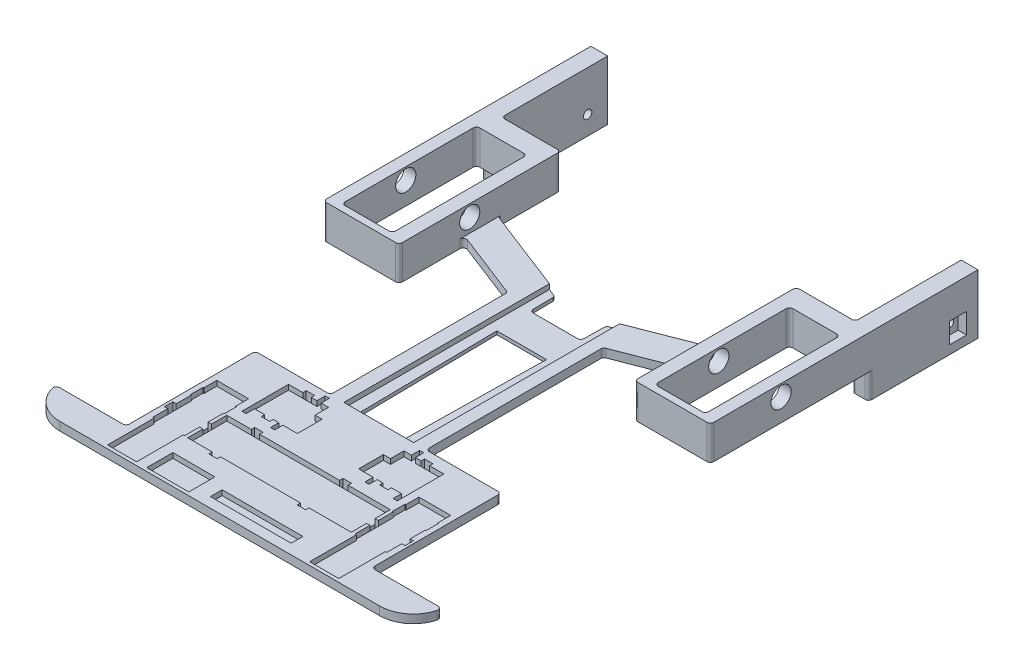
from build123d import *

# Parameters (mm, degrees)
BOSS_EXTRUDE1_DEPTH      = 5
BOSS_EXTRUDE2_DEPTH      = 10
BOSS_EXTRUDE3_START      = -230
BOSS_EXTRUDE3_DEPTH      = 10
SKETCH5_W                = 30
SKETCH5_H                = 15.26
BOSS_EXTRUDE6_DEPTH      = 10
BOSS_EXTRUDE4_OUTLINE_W  = 30
BOSS_EXTRUDE4_OUTLINE_H  = 80
BOSS_EXTRUDE4_DEPTH      = 20
SKETCH5_4_W              = 10.2
SKETCH5_4_H              = 12.2
SKETCH5_4_R              = 2.5
CUT_EXTRUDE6_DEPTH       = 5
SKETCH5_5_R              = 2.5
CUT_EXTRUDE7_DEPTH       = 10
SKETCH3_10_W             = 97.2
SKETCH3_10_H             = 23.25
SKETCH3_10_W_2           = 48
SKETCH3_10_H_2           = 7
SKETCH3_10_W_3           = 25
SKETCH3_10_H_3           = 15.5
CUT_EXTRUDE11_DEPTH      = 3
CUT_EXTRUDE13_DEPTH      = 408.535581269
CUT_EXTRUDE13_DEPTH_BACK = 408.535581269
SKETCH11_W               = 4
SKETCH11_H               = 4.74
SKETCH11_W_2             = 80
BOSS_EXTRUDE8_START      = -230
SKETCH5_9_W              = 30
SKETCH5_9_H              = 15.26
BOSS_EXTRUDE8_DEPTH      = 10
CUT_EXTRUDE14_DEPTH      = 408.259438196
CUT_EXTRUDE14_DEPTH_BACK = 408.259438196
SKETCH3_12_W             = 30
SKETCH3_12_H             = 80
FILLET4_R                = 2
SKETCH3_W                = 2
SKETCH3_H                = 5
SKETCH3_W_2              = 5
SKETCH3_H_2              = 2
CUT_EXTRUDE15_DEPTH      = 408.259438196
FILLET5_R                = 2
CUT_EXTRUDE16_START      = -220
SKETCH5_10_R             = 2.5
CUT_EXTRUDE16_DEPTH      = 5
CUT_EXTRUDE17_DEPTH      = 408.535581269
CUT_EXTRUDE17_DEPTH_BACK = 408.535581269
SKETCH11_4_W             = 5
SKETCH11_4_H             = 4.74


# Read off the part's stored shape, not the designer's step: Boss-Extrude4
with BuildPart() as part:
    # Sketch2 → Boss-Extrude1 (new body)
    with BuildSketch(Plane(origin=(0, 0, 0), x_dir=(1, 0, 0), z_dir=(0, 1, 0))):
        with BuildLine():
            Line((20, 0), (210, 0))
            ThreePointArc((210, 0), (224.142135624, 5.857864376), (230, 20))
            Line((230, 20), (230, 310.5))
            Line((230, 310.5), (0, 310.5))
            Line((0, 310.5), (0, 20))
            ThreePointArc((0, 20), (5.857864376, 5.857864376), (20, 0))
        make_face()
    extrude(amount=BOSS_EXTRUDE1_DEPTH)

    # Sketch4 → Boss-Extrude2 (add)
    with BuildSketch(Plane(origin=(230, 0, 0), x_dir=(0, 0, -1), z_dir=(1, 0, 0))):
        Polygon((310.5, 5), (335.5, 5), (335.5, -15), (270.5, -15), (270.5, 0), (310.5, 0), align=None)
    extrude(amount=-BOSS_EXTRUDE2_DEPTH)

    # Sketch4<3> → Boss-Extrude3 (add)
    with BuildSketch(Plane(origin=(230, 0, 0), x_dir=(0, 0, -1), z_dir=(1, 0, 0)).offset(BOSS_EXTRUDE3_START)):
        Polygon((310.5, 5), (335.5, 5), (335.5, -15), (270.5, -15), (270.5, 0), (310.5, 0), align=None)
    extrude(amount=BOSS_EXTRUDE3_DEPTH)

    # Sketch5 → Boss-Extrude6 (add)
    with BuildSketch(Plane(origin=(230, 0, 0), x_dir=(0, 0, -1), z_dir=(1, 0, 0))):
        with Locations((320.5, 12.63)):
            Rectangle(SKETCH5_W, SKETCH5_H)
    extrude(amount=-BOSS_EXTRUDE6_DEPTH)

    # Boss-Extrude4 outline → Boss-Extrude4 (add)
    # profile 1 of 2: a face of its own
    with BuildSketch(Plane(origin=(0, 5, 0), x_dir=(1, 0, 0), z_dir=(0, 1, 0))):
        Polygon((10, 310.5), (0, 310.5), (0, 176.5), (45, 176.5), (45, 272.5), (10, 272.5), align=None)
        with Locations((22, 220.5)):
            Rectangle(BOSS_EXTRUDE4_OUTLINE_W, BOSS_EXTRUDE4_OUTLINE_H, mode=Mode.SUBTRACT)
    # profile 2 of 2: a face of its own
    with BuildSketch(Plane(origin=(0, 5, 0), x_dir=(1, 0, 0), z_dir=(0, 1, 0))):
        Polygon((230, 176.5), (230, 305.5), (220, 305.5), (220, 272.5), (185, 272.5), (185, 176.5), align=None)
        with Locations((208, 220.5)):
            Rectangle(BOSS_EXTRUDE4_OUTLINE_W, BOSS_EXTRUDE4_OUTLINE_H, mode=Mode.SUBTRACT)
    extrude(amount=BOSS_EXTRUDE4_DEPTH)

    # Sketch5<4> → Cut-Extrude6 (cut)
    with BuildSketch(Plane(origin=(230, 0, 0), x_dir=(0, 0, -1), z_dir=(1, 0, 0))):
        with Locations((323.575111524, -3.821447191)):
            Rectangle(SKETCH5_4_W, SKETCH5_4_H)
        with Locations((323.575111524, -3.821447191)):
            Circle(SKETCH5_4_R, mode=Mode.SUBTRACT)
    extrude(amount=-CUT_EXTRUDE6_DEPTH, mode=Mode.SUBTRACT)

    # Sketch5<5> → Cut-Extrude7 (cut)
    with BuildSketch(Plane(origin=(230, 0, 0), x_dir=(0, 0, -1), z_dir=(1, 0, 0))):
        with Locations((323.575111524, -3.821447191)):
            Circle(SKETCH5_5_R)
    extrude(amount=-CUT_EXTRUDE7_DEPTH, mode=Mode.SUBTRACT)

    # Sketch3<10> → Cut-Extrude11 (cut)
    with BuildSketch(Plane(origin=(0, 5, 0), x_dir=(1, 0, 0), z_dir=(0, 1, 0))):
        Polygon((45, 60.05), (45, 52.55), (45.5, 52.55), (45.5, 29.7), (46.3, 29.7), (46.3, 2), (63.6, 2), (63.6, 29.7), (64.4, 29.7), (64.4, 52.55), (64.9, 52.55), (64.9, 60.05), (64.4, 60.05), (64.4, 67.7), (45.5, 67.7), (45.5, 60.05), align=None)
        Polygon((94.6, 216.256113373), (94.6, 94.13506659), (101.572588509, 94.13506659), (100.260421657, 179.359966054), (129.755553449, 179.359966054), (128.429815253, 94.13506659), (136.040734682, 94.13506659), (136.040734682, 216.50470663), (130.298713065, 214.276907981), (130.066668676, 199.359966054), (99.952491262, 199.359966054), (99.722951686, 214.268502456), align=None)
        Polygon((88.195, 91.92), (86.6, 91.92), (85.735, 91.92), (85.735, 87.01), (68.855, 87.01), (68.855, 59.3), (71.345, 59.3), (71.345, 64.3), (85.745, 64.3), (85.745, 59.43), (88.205, 59.43), (88.205, 64.3), (96.805, 64.3), (96.805, 79.04), (92.605, 79.04), (92.605, 87.01), (88.195, 87.01), align=None)
        Polygon((137.395, 79.04), (133.195, 79.04), (133.195, 64.3), (141.795, 64.3), (141.795, 59.43), (144.255, 59.43), (144.255, 64.3), (158.655, 64.3), (158.655, 59.3), (161.145, 59.3), (161.145, 87.01), (144.265, 87.01), (144.265, 91.92), (143.4, 91.92), (141.805, 91.92), (141.805, 87.01), (137.395, 87.01), align=None)
        with Locations((115, 41.125)):
            Rectangle(SKETCH3_10_W, SKETCH3_10_H)
        Polygon((185, 52.55), (185, 60.05), (184.5, 60.05), (184.5, 67.7), (165.6, 67.7), (165.6, 60.05), (165.1, 60.05), (165.1, 52.55), (165.6, 52.55), (165.6, 29.7), (166.4, 29.7), (166.4, 2), (183.7, 2), (183.7, 29.7), (184.5, 29.7), (184.5, 52.55), align=None)
        with Locations((127.4, 9.5)):
            Rectangle(SKETCH3_10_W_2, SKETCH3_10_H_2)
        with Locations((82.1, 9.75)):
            Rectangle(SKETCH3_10_W_3, SKETCH3_10_H_3)
    extrude(amount=-CUT_EXTRUDE11_DEPTH, mode=Mode.SUBTRACT)

    # Sketch11 → Cut-Extrude13 (cut, two sides: drawn at the far end of the back side and taken through both)
    with BuildSketch(Plane(origin=(230, 0, 0), x_dir=(0, 0, -1), z_dir=(1, 0, 0)).offset(-CUT_EXTRUDE13_DEPTH_BACK)):
        with Locations((178.5, 22.63)):
            Rectangle(SKETCH11_W, SKETCH11_H)
        with Locations((220.5, 22.63)):
            Rectangle(SKETCH11_W_2, SKETCH11_H)
        Polygon((305.5, 25), (260.5, 25), (260.5, 20.26), (270.5, 20.26), (305.5, 20.26), align=None)
        with BuildLine():
            ThreePointArc((224.5, 13.26), (218.5, 19.26), (212.5, 13.26))
            Line((212.5, 13.26), (224.5, 13.26))
        make_face()
        with BuildLine():
            Line((224.5, 13.26), (212.5, 13.26))
            ThreePointArc((212.5, 13.26), (218.5, 7.26), (224.5, 13.26))
        make_face()
    extrude(amount=CUT_EXTRUDE13_DEPTH + CUT_EXTRUDE13_DEPTH_BACK, mode=Mode.SUBTRACT)

    # Sketch5<9> → Boss-Extrude8 (add)
    with BuildSketch(Plane(origin=(230, 0, 0), x_dir=(0, 0, -1), z_dir=(1, 0, 0)).offset(BOSS_EXTRUDE8_START)):
        with Locations((320.5, 12.63)):
            Rectangle(SKETCH5_9_W, SKETCH5_9_H)
    extrude(amount=BOSS_EXTRUDE8_DEPTH)

    # Sketch3<12> → Cut-Extrude14 (cut, two sides: drawn at the far end of the back side and taken through both)
    with BuildSketch(Plane(origin=(0, 5, 0), x_dir=(1, 0, 0), z_dir=(0, 1, 0)).offset(-CUT_EXTRUDE14_DEPTH_BACK)):
        Polygon((0, 176.5), (0, 17.3), (42, 17.3), (42, 94.13506659), (86.6, 94.13506659), (86.6, 199.359966054), (45, 215.5), (45, 176.5), align=None)
        Polygon((100.260421657, 179.359966054), (101.572588509, 94.13506659), (128.429815253, 94.13506659), (129.755553449, 179.359966054), align=None)
        Polygon((45, 235.5), (99.722951686, 214.268502456), (99.952491262, 199.359966054), (130.066668676, 199.359966054), (130.298713065, 214.276907981), (185, 235.5), (185, 272.5), (220, 272.5), (220, 310.5), (10, 310.5), (10, 272.5), (45, 272.5), align=None)
        Polygon((143.4, 199.359966054), (143.4, 94.13506659), (188, 94.13506659), (188, 17.3), (230, 17.3), (230, 176.5), (185, 176.5), (185, 215.5), align=None)
        with Locations((22, 220.5)):
            Rectangle(SKETCH3_12_W, SKETCH3_12_H)
        with Locations((208, 220.5)):
            Rectangle(SKETCH3_12_W, SKETCH3_12_H)
    extrude(amount=CUT_EXTRUDE14_DEPTH + CUT_EXTRUDE14_DEPTH_BACK, mode=Mode.SUBTRACT)

    # Fillet4
    fillet4_edges = [part.edges().sort_by_distance(p)[0] for p in [
        (7, 10.13, -260.5),
        (7, 10.13, -180.5),
        (37, 10.13, -180.5),
        (37, 10.13, -260.5),
        (223, 10.13, -180.5),
        (223, 10.13, -260.5),
        (193, 10.13, -260.5),
        (193, 10.13, -180.5),
    ]]
    fillet(fillet4_edges, radius=FILLET4_R)

    # Sketch3 → Cut-Extrude15 (cut, through all)
    with BuildSketch(Plane(origin=(0, 5, 0), x_dir=(1, 0, 0), z_dir=(0, 1, 0))):
        with Locations((44.5, 41.125)):
            Rectangle(SKETCH3_W, SKETCH3_H)
        with Locations((79.855, 88.01)):
            Rectangle(SKETCH3_W_2, SKETCH3_H_2)
        with Locations((65.4, 41.125)):
            Rectangle(SKETCH3_W, SKETCH3_H)
        with Locations((150.145, 88.01)):
            Rectangle(SKETCH3_W_2, SKETCH3_H_2)
        with Locations((79.855, 63.3)):
            Rectangle(SKETCH3_W_2, SKETCH3_H_2)
        with Locations((83.469043762, 28.5)):
            Rectangle(SKETCH3_W_2, SKETCH3_H_2)
        with Locations((150.145, 63.3)):
            Rectangle(SKETCH3_W_2, SKETCH3_H_2)
        with Locations((83.469043762, 53.75)):
            Rectangle(SKETCH3_W_2, SKETCH3_H_2)
        with Locations((135.969043762, 28.5)):
            Rectangle(SKETCH3_W_2, SKETCH3_H_2)
        with Locations((185.5, 41.125)):
            Rectangle(SKETCH3_W, SKETCH3_H)
        with Locations((135.969043762, 53.75)):
            Rectangle(SKETCH3_W_2, SKETCH3_H_2)
        with Locations((164.6, 41.125)):
            Rectangle(SKETCH3_W, SKETCH3_H)
    extrude(amount=-CUT_EXTRUDE15_DEPTH, mode=Mode.SUBTRACT)

    # Fillet5
    fillet5_edges = [part.edges().sort_by_distance(p)[0] for p in [
        (10, 10.13, -272.5),
        (0, -7.5, -270.5),
        (10, -7.5, -270.5),
        (0, 10.13, -176.5),
        (45, 10.13, -176.5),
        (185, 10.13, -176.5),
        (230, 10.13, -176.5),
        (45, 2.5, -215.5),
        (86.6, 2.5, -199.359966054),
        (86.6, 2.5, -94.13506659),
        (42, 2.5, -94.13506659),
        (42, 2.5, -17.3),
        (0.183088031, 2.5, -17.3),
        (229.816911969, 2.5, -17.3),
        (188, 2.5, -17.3),
        (188, 2.5, -94.13506659),
        (143.4, 2.5, -94.13506659),
        (143.4, 2.5, -199.359966054),
        (185, 2.5, -215.5),
        (230, -7.5, -270.5),
        (220, -7.5, -270.5),
        (220, 10.13, -272.5),
        (185, 10.13, -272.5),
        (185, 2.5, -235.5),
        (130.298713065, 1, -214.276907981),
        (130.066668676, 1, -199.359966054),
        (99.952491262, 1, -199.359966054),
        (99.722951686, 1, -214.268502456),
        (45, 2.5, -235.5),
        (45, 10.13, -272.5),
    ]]
    fillet(fillet5_edges, radius=FILLET5_R - 0.0001)  # a hair under: the kernel refuses the full size

    # Sketch5<10> → Cut-Extrude16 (cut)
    with BuildSketch(Plane(origin=(230, 0, 0), x_dir=(0, 0, -1), z_dir=(1, 0, 0)).offset(CUT_EXTRUDE16_START)):
        with Locations((323.575111524, -3.821447191)):
            Circle(SKETCH5_10_R)
    extrude(amount=-CUT_EXTRUDE16_DEPTH, mode=Mode.SUBTRACT)

    # Sketch11<4> → Cut-Extrude17 (cut, two sides: drawn at the far end of the back side and taken through both)
    with BuildSketch(Plane(origin=(230, 0, 0), x_dir=(0, 0, -1), z_dir=(1, 0, 0)).offset(-CUT_EXTRUDE17_DEPTH_BACK)):
        with Locations((308, 22.63)):
            Rectangle(SKETCH11_4_W, SKETCH11_4_H)
    extrude(amount=CUT_EXTRUDE17_DEPTH + CUT_EXTRUDE17_DEPTH_BACK, mode=Mode.SUBTRACT)


solid = part.part
